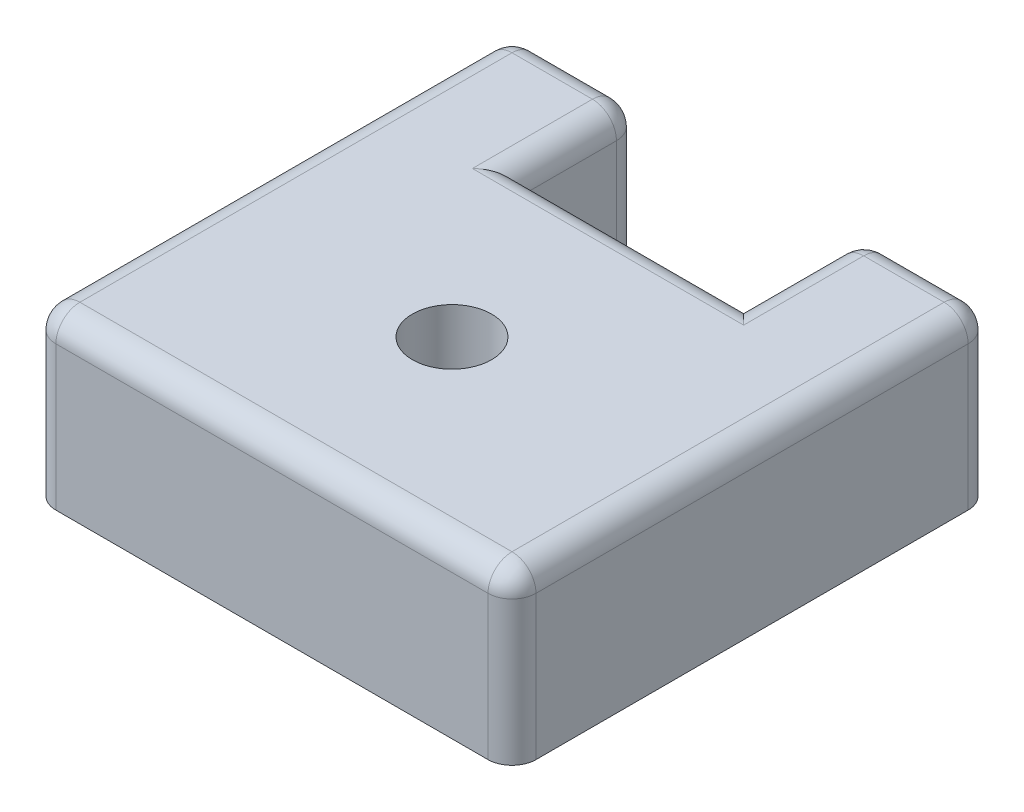
from build123d import *

# Parameters (mm, degrees)
BOSS_EXTRUDE1_DEPTH = 7
FILLET1_R           = 1
SKETCH3_R           = 1.65
CUT_EXTRUDE1_DEPTH  = 30.137604569


with BuildPart() as part:
    # Sketch2 → Boss-Extrude1 (new body)
    with BuildSketch(Plane(origin=(0, 0, 0), x_dir=(1, 0, 0), z_dir=(0, 1, 0))):
        Polygon((14.65, 20), (20, 20), (20, 0), (0, 0), (0, 20), (5.35, 20), (5.35, 15), (14.65, 15), align=None)
    extrude(amount=BOSS_EXTRUDE1_DEPTH)

    # Fillet1
    fillet1_edges = [part.edges().sort_by_distance(p)[0] for p in [
        (0, 7, -10),
        (2.675, 7, -20),
        (5.35, 7, -17.5),
        (10, 7, -15),
        (14.65, 7, -17.5),
        (17.325, 7, -20),
        (20, 7, -10),
        (10, 7, 0),
        (0, 3.5, 0),
        (20, 3.5, 0),
        (20, 3.5, -20),
        (0, 3.5, -20),
        (14.65, 3.5, -20),
        (5.35, 3.5, -20),
    ]]
    fillet(fillet1_edges, radius=FILLET1_R)

    # Sketch3 → Cut-Extrude1 (cut, through all)
    with BuildSketch(Plane(origin=(0, 7, 0), x_dir=(1, 0, 0), z_dir=(0, 1, 0))):
        with Locations((10, 7.5)):
            Circle(SKETCH3_R)
    extrude(amount=-CUT_EXTRUDE1_DEPTH, mode=Mode.SUBTRACT)


solid = part.part
